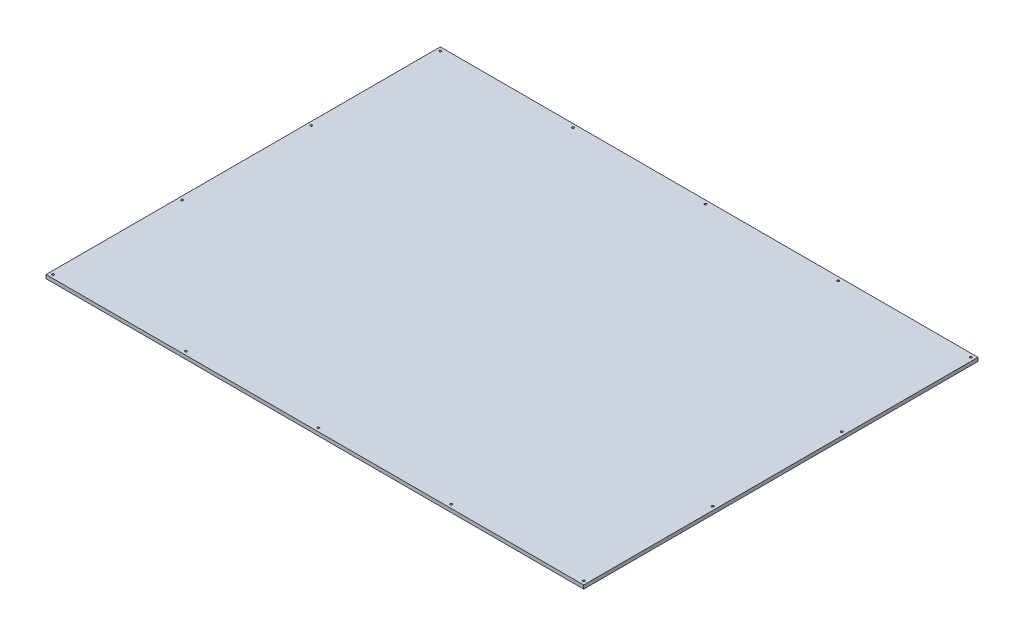
from build123d import *

# Parameters (mm, degrees)
SKETCH1_W           = 750
SKETCH1_H           = 550
BOSS_EXTRUDE1_DEPTH = 5
SKETCH2_R           = 1.5
CUT_EXTRUDE1_DEPTH  = 466.053760333


with BuildPart() as part:
    # Sketch1 → Boss-Extrude1 (new body)
    with BuildSketch(Plane(origin=(0, 0, 0), x_dir=(1, 0, 0), z_dir=(0, 1, 0))):
        Rectangle(SKETCH1_W, SKETCH1_H)
    extrude(amount=BOSS_EXTRUDE1_DEPTH)

    # Sketch2 → Cut-Extrude1 (cut, through all)
    with BuildSketch(Plane(origin=(0, 5, 0), x_dir=(1, 0, 0), z_dir=(0, 1, 0))):
        with Locations((-370, 270)):
            Circle(SKETCH2_R)
        with Locations((-185, 270)):
            Circle(SKETCH2_R)
        with Locations((0, 270)):
            Circle(SKETCH2_R)
        with Locations((185, 270)):
            Circle(SKETCH2_R)
        with Locations((370, 270)):
            Circle(SKETCH2_R)
        with Locations((-370, 90)):
            Circle(SKETCH2_R)
        with Locations((-370, -90)):
            Circle(SKETCH2_R)
        with Locations((-370, -270)):
            Circle(SKETCH2_R)
        with Locations((370, -270)):
            Circle(SKETCH2_R)
        with Locations((185, -270)):
            Circle(SKETCH2_R)
        with Locations((0, -270)):
            Circle(SKETCH2_R)
        with Locations((-185, -270)):
            Circle(SKETCH2_R)
        with Locations((370, -90)):
            Circle(SKETCH2_R)
        with Locations((370, 90)):
            Circle(SKETCH2_R)
    extrude(amount=-CUT_EXTRUDE1_DEPTH, mode=Mode.SUBTRACT)


solid = part.part
